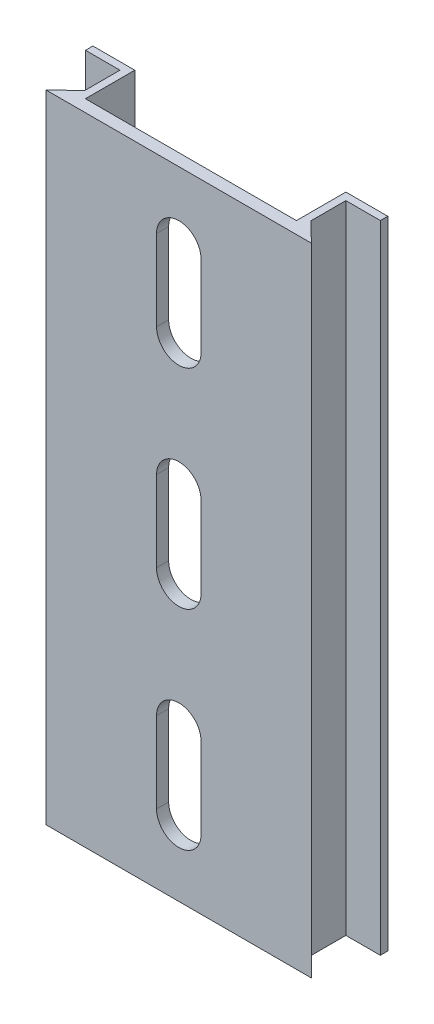
from build123d import *

# Parameters (mm, degrees)
BOSS_EXTRUDE1_DEPTH  = 38.1
CUT_EXTRUDE1_DEPTH   = 43.632104862
LPATTERN1_COUNT      = 2
LPATTERN1_PITCH      = 25
LPATTERN1_COUNT_DIR2 = 2
LPATTERN1_PITCH_DIR2 = 25


with BuildPart() as part:
    # Sketch1 → Boss-Extrude1 (new, symmetric)
    with BuildSketch(Plane(origin=(0, 0, 0), x_dir=(1, 0, 0), z_dir=(0, 1, 0))):
        Polygon((-15.875, 0), (15.875, 0), (13.5255, 2.286), (13.5255, 6.477), (17.653, 6.477), (17.653, 7.366), (12.6365, 7.366), (12.6365, 1.4478), (-12.6365, 1.4478), (-12.6365, 7.366), (-17.653, 7.366), (-17.653, 6.477), (-13.5255, 6.477), (-13.5255, 2.286), align=None)
    extrude(amount=BOSS_EXTRUDE1_DEPTH, both=True)

    # Sketch2 → Cut-Extrude1 (cut, through all)
    with BuildSketch(Plane.XY):
        with BuildLine():
            Line((-2.667, -4.833), (-2.667, 4.833))
            ThreePointArc((-2.667, 4.833), (0, 7.5), (2.667, 4.833))
            Line((2.667, 4.833), (2.667, -4.833))
            ThreePointArc((2.667, -4.833), (0, -7.5), (-2.667, -4.833))
        make_face()
    cut_extrude1 = extrude(amount=-CUT_EXTRUDE1_DEPTH, mode=Mode.SUBTRACT)

    # LPattern1: Cut-Extrude1 2 × 2
    with Locations(*[Vector(0, -1, 0) * (i * LPATTERN1_PITCH) + Vector(0, 1, 0) * (j * LPATTERN1_PITCH_DIR2) for i in range(LPATTERN1_COUNT) for j in range(LPATTERN1_COUNT_DIR2) if (i, j) != (0, 0)]):
        add(cut_extrude1, mode=Mode.SUBTRACT)


solid = part.part
